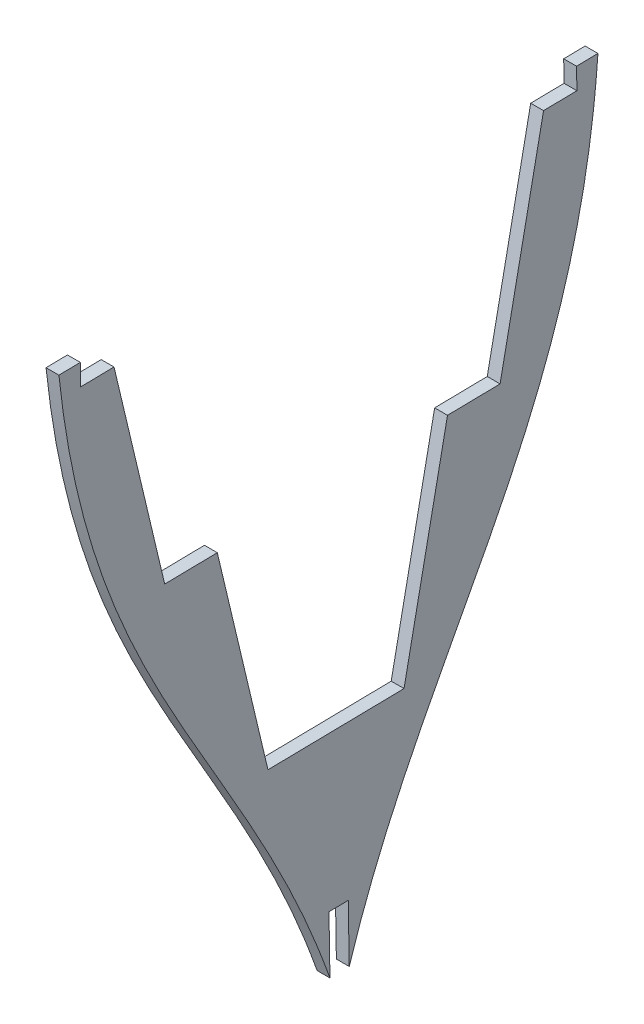
from build123d import *

# Parameters (mm, degrees)
BOSS_EXTRU_3_DEPTH      = 6
ENL_V_MAT_EXTRU_1_DEPTH = 10


with BuildPart() as part:
    # Esquisse2 → Boss.-Extru.3 (new body)
    with BuildSketch(Plane(origin=(0, 0, 0), x_dir=(0, 0, -1), z_dir=(1, 0, 0))):
        with BuildLine():
            Line((119.71086506, 366.083235375), (109.712285727, 365.91467876))
            Line((109.712285727, 365.91467876), (109.880842343, 355.916099427))
            Line((109.880842343, 355.916099427), (94.309526281, 355.653597301))
            Line((94.309526281, 355.653597301), (74.015767299, 255.297275271))
            Line((74.015767299, 255.297275271), (49.464354264, 254.883386163))
            Line((49.464354264, 254.883386163), (29.170595283, 154.527064133))
            Line((29.170595283, 154.527064133), (-34.36259149, 153.456018079))
            Line((-34.36259149, 153.456018079), (-58.027482781, 253.071282698))
            Line((-58.027482781, 253.071282698), (-82.578895816, 252.65739359))
            Line((-82.578895816, 252.65739359), (-106.243787108, 352.272658209))
            Line((-106.243787108, 352.272658209), (-121.815103171, 352.010156082))
            Line((-121.815103171, 352.010156082), (-121.983659786, 362.008735415))
            Line((-121.983659786, 362.008735415), (-131.982239118, 361.840178799))
            add(Edge.make_bspline(
                [(-131.982239118, 361.840178799), (-116.52990759, 214.445257513), (-39.349503787, 163.197017766), (-0.684991121, 40.632864193)],
                knots=[0, 0, 0, 0, 1, 1, 1, 1], degree=3))
            add(Edge.make_bspline(
                [(119.71086506, 366.083235375), (109.23548586, 218.251223276), (33.826338548, 164.430620253), (-0.684991121, 40.632864193)],
                knots=[0, 0, 0, 0, 1, 1, 1, 1], degree=3))
        make_face()
    extrude(amount=BOSS_EXTRU_3_DEPTH)

    # Esquisse3 → Enlèv. mat.-Extru.1 (cut)
    with BuildSketch(Plane(origin=(6, 0, 0), x_dir=(0, 0, -1), z_dir=(1, 0, 0))):
        Polygon((-5.424231097, 54.786369045), (-5.879333959, 81.782533242), (3.11938744, 81.934234196), (3.574490302, 54.938069999), (9.988201973, 34.19819186), (-20.434477063, 34.19819186), align=None)
    extrude(amount=-ENL_V_MAT_EXTRU_1_DEPTH, mode=Mode.SUBTRACT)


solid = part.part
